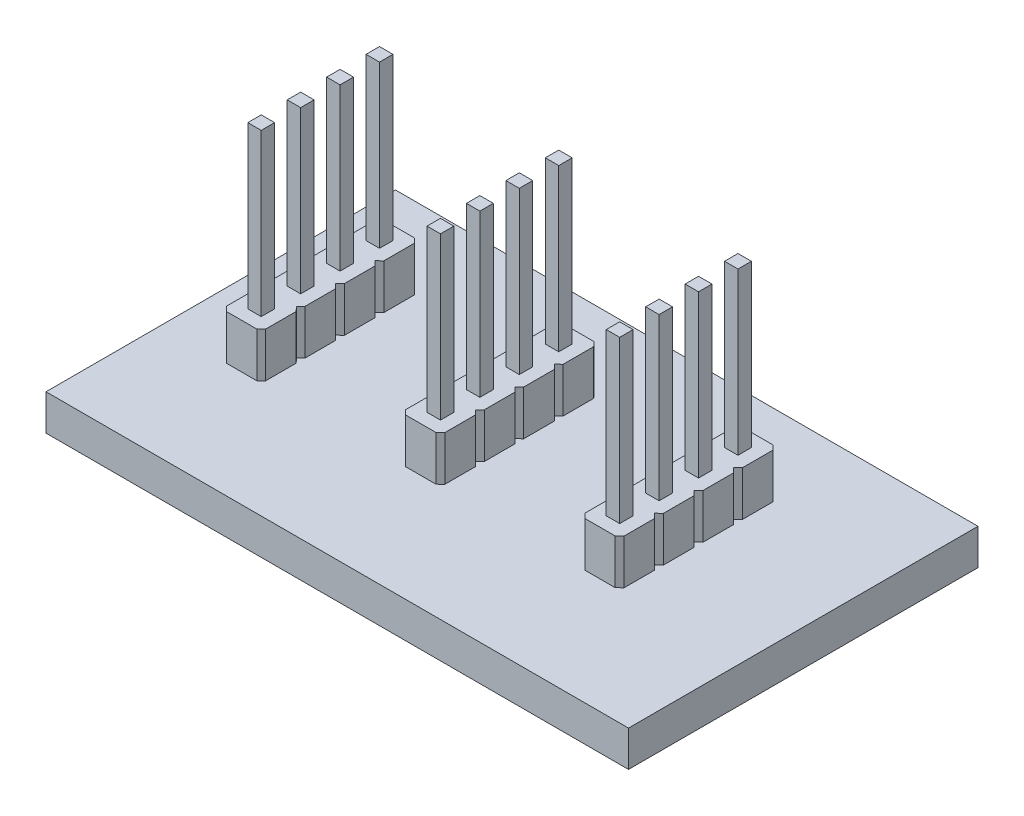
from build123d import *

# Parameters (mm, degrees)
ESBO_O1_W                  = 32.5
ESBO_O1_H                  = 19.5
RESSALTO_EXTRUS_O1_DEPTH   = 2
RESSALTO_EXTRUS_O2_DEPTH   = 2.5
ESBO_O3_W                  = 0.75
ESBO_O3_H                  = 0.75
RESSALTO_EXTRUS_O3_DEPTH   = 9
PADR_O_LINEAR1_COUNT       = 4
PADR_O_LINEAR1_PITCH       = 2.2
PADR_O_START               = 2
PADR_O_LINEAR2_DEPTH       = 2.5
PADR_O_START_2             = 4.5
PADR_O_LINEAR2_2_OUTLINE_W = 0.75
PADR_O_LINEAR2_2_OUTLINE_H = 0.75
PADR_O_LINEAR2_2_DEPTH     = 9


# Read off the part's stored shape, not the designer's step: Padrão linear2
with BuildPart() as part:
    # Esboço1 → Ressalto-extrusão1 (new body)
    with BuildSketch(Plane(origin=(0, 0, 0), x_dir=(1, 0, 0), z_dir=(0, 1, 0))):
        Rectangle(ESBO_O1_W, ESBO_O1_H)
    extrude(amount=RESSALTO_EXTRUS_O1_DEPTH)

    # Esboço2 → Ressalto-extrusão2 (add)
    with BuildSketch(Plane(origin=(0, 2, 0), x_dir=(1, 0, 0), z_dir=(0, 1, 0))):
        Polygon((-12.851070796, 5.211508821), (-12.595390899, 5.461508821), (-10.895517077, 5.461508821), (-10.651070796, 5.211508821), (-10.651070796, 3.505955102), (-10.901070796, 3.261508821), (-12.601070796, 3.261508821), (-12.851070796, 3.517188718), align=None)
    ressalto_extrus_o2 = extrude(amount=RESSALTO_EXTRUS_O2_DEPTH)

    # Esboço3 → Ressalto-extrusão3 (add)
    with BuildSketch(Plane(origin=(0, 4.5, 0), x_dir=(1, 0, 0), z_dir=(0, 1, 0))):
        with Locations((-11.751070796, 4.358731961)):
            Rectangle(ESBO_O3_W, ESBO_O3_H)
    ressalto_extrus_o3 = extrude(amount=RESSALTO_EXTRUS_O3_DEPTH)

    # Padrão linear1: Ressalto-extrusão2, Ressalto-extrusão3 ×4
    with Locations(*[(0, 0, i * PADR_O_LINEAR1_PITCH) for i in range(1, PADR_O_LINEAR1_COUNT)]):
        add(ressalto_extrus_o2)
        add(ressalto_extrus_o3)

    # Padrão linear2 outline → Padrão linear2 (add)
    with BuildSketch(Plane(origin=(0, 0, 0), x_dir=(1, 0, 0), z_dir=(0, 1, 0)).offset(PADR_O_START)):
        Polygon((-0.895517077, 5.461508821), (-2.595390899, 5.461508821), (-2.851070796, 5.211508821), (-2.851070796, 3.517188718), (-2.598294638, 3.258669589), (-2.851070796, 3.011508821), (-2.851070796, 1.317188718), (-2.598294638, 1.058669589), (-2.851070796, 0.811508821), (-2.851070796, -0.882811282), (-2.598294638, -1.141330411), (-2.851070796, -1.388491179), (-2.851070796, -3.082811282), (-2.601070796, -3.338491179), (-0.901070796, -3.338491179), (-0.651070796, -3.094044898), (-0.651070796, -1.388491179), (-0.898231564, -1.13571502), (-0.651070796, -0.894044898), (-0.651070796, 0.811508821), (-0.898231564, 1.06428498), (-0.651070796, 1.305955102), (-0.651070796, 3.011508821), (-0.898231564, 3.26428498), (-0.651070796, 3.505955102), (-0.651070796, 5.211508821), align=None)
        Polygon((9.104482923, 5.461508821), (7.404609101, 5.461508821), (7.148929204, 5.211508821), (7.148929204, 3.517188718), (7.401705362, 3.258669589), (7.148929204, 3.011508821), (7.148929204, 1.317188718), (7.401705362, 1.058669589), (7.148929204, 0.811508821), (7.148929204, -0.882811282), (7.401705362, -1.141330411), (7.148929204, -1.388491179), (7.148929204, -3.082811282), (7.398929204, -3.338491179), (9.098929204, -3.338491179), (9.348929204, -3.094044898), (9.348929204, -1.388491179), (9.101768436, -1.13571502), (9.348929204, -0.894044898), (9.348929204, 0.811508821), (9.101768436, 1.06428498), (9.348929204, 1.305955102), (9.348929204, 3.011508821), (9.101768436, 3.26428498), (9.348929204, 3.505955102), (9.348929204, 5.211508821), align=None)
    extrude(amount=PADR_O_LINEAR2_DEPTH)

    # Padr_o linear2 2 outline → Padr_o linear2 2 (add)
    with BuildSketch(Plane(origin=(0, 0, 0), x_dir=(1, 0, 0), z_dir=(0, 1, 0)).offset(PADR_O_START_2)):
        with Locations((-1.751070796, 4.358731961)):
            Rectangle(PADR_O_LINEAR2_2_OUTLINE_W, PADR_O_LINEAR2_2_OUTLINE_H)
        with Locations((8.248929204, 4.358731961)):
            Rectangle(PADR_O_LINEAR2_2_OUTLINE_W, PADR_O_LINEAR2_2_OUTLINE_H)
        with Locations((-1.751070796, 2.158731961)):
            Rectangle(PADR_O_LINEAR2_2_OUTLINE_W, PADR_O_LINEAR2_2_OUTLINE_H)
        with Locations((8.248929204, 2.158731961)):
            Rectangle(PADR_O_LINEAR2_2_OUTLINE_W, PADR_O_LINEAR2_2_OUTLINE_H)
        with Locations((-1.751070796, -0.041268039)):
            Rectangle(PADR_O_LINEAR2_2_OUTLINE_W, PADR_O_LINEAR2_2_OUTLINE_H)
        with Locations((8.248929204, -0.041268039)):
            Rectangle(PADR_O_LINEAR2_2_OUTLINE_W, PADR_O_LINEAR2_2_OUTLINE_H)
        with Locations((-1.751070796, -2.241268039)):
            Rectangle(PADR_O_LINEAR2_2_OUTLINE_W, PADR_O_LINEAR2_2_OUTLINE_H)
        with Locations((8.248929204, -2.241268039)):
            Rectangle(PADR_O_LINEAR2_2_OUTLINE_W, PADR_O_LINEAR2_2_OUTLINE_H)
    extrude(amount=PADR_O_LINEAR2_2_DEPTH)


solid = part.part
